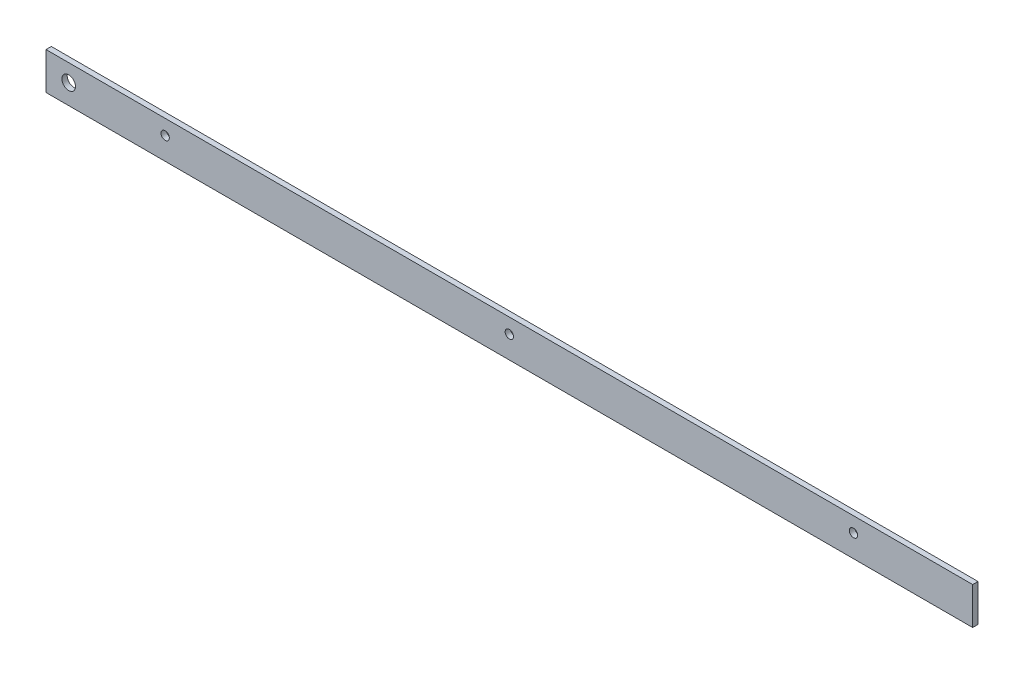
from build123d import *

# Parameters (mm, degrees)
SKETCH1_R           = 4.0635
SKETCH1_R_2         = 2.4892
BOSS_EXTRUDE1_DEPTH = 3.175


with BuildPart() as part:
    # Sketch1 → Boss-Extrude1 (new body)
    with BuildSketch(Plane.XY):
        Polygon((0, 17.391988029), (0, -4.833011971), (553.1, -4.833011971), (553.1, 17.391988029), (420.694085909, 17.391988029), align=None)
        with Locations((13.54, 7.026988029)):
            Circle(SKETCH1_R, mode=Mode.SUBTRACT)
        with Locations((71.12, 8.509488029)):
            Circle(SKETCH1_R_2, mode=Mode.SUBTRACT)
        with Locations((276.55, 8.509488029)):
            Circle(SKETCH1_R_2, mode=Mode.SUBTRACT)
        with Locations((481.98, 8.509488029)):
            Circle(SKETCH1_R_2, mode=Mode.SUBTRACT)
    extrude(amount=BOSS_EXTRUDE1_DEPTH)


solid = part.part
